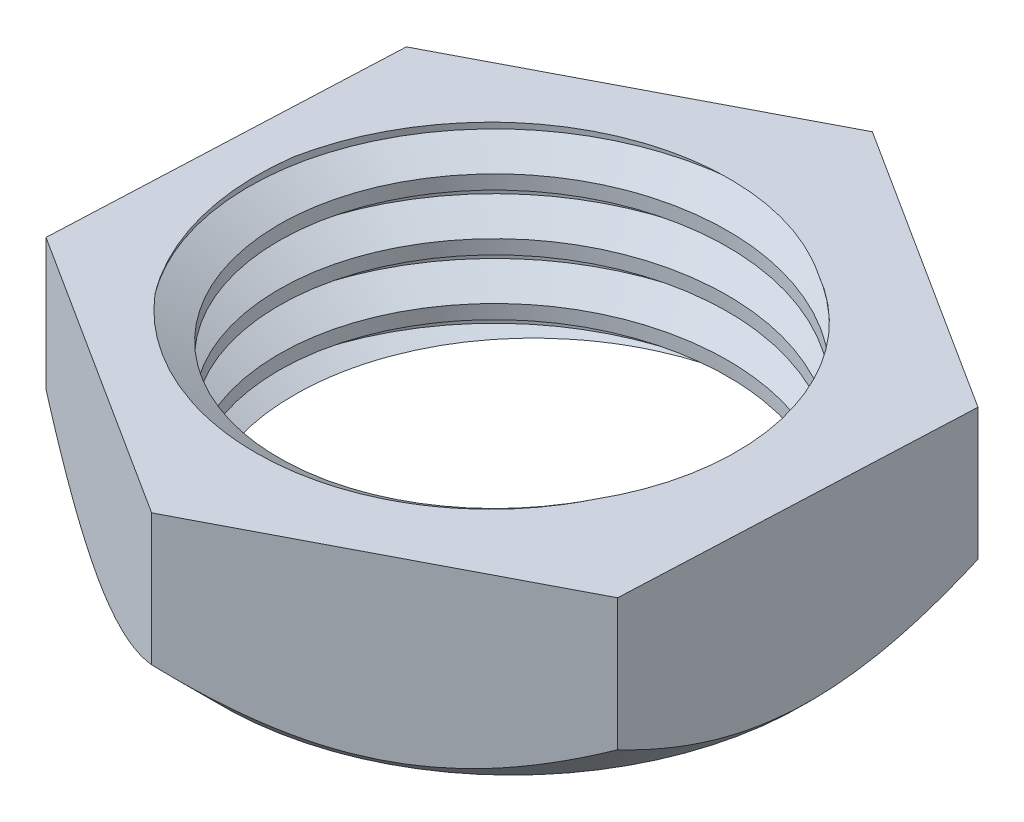
from build123d import *

# Parameters (mm, degrees)
SKETCH1_R           = 6
BOSS_EXTRUDE1_DEPTH = 5
THREAD1_PITCH       = 1.5
SKETCH5_OUTSIDE_W   = 43.428
SKETCH5_OUTSIDE_H   = 45.496
SKETCH5_OUTSIDE_R   = 7.756260738
CUT_EXTRUDE1_DEPTH  = 10
CUT_EXTRUDE1_DRAFT  = -45


with BuildPart() as part:
    # Sketch1 → Boss-Extrude1 (new body)
    with BuildSketch(Plane(origin=(0, 0, 0), x_dir=(1, 0, 0), z_dir=(0, 1, 0))):
        Polygon((7.789575032, -4.965466156), (8.195007349, 4.263236785), (0.405432317, 9.228702941), (-7.789575032, 4.965466156), (-8.195007349, -4.263236785), (-0.405432317, -9.228702941), align=None)
        with Locations(Location((0, 0, 0), (0, 0, 270))):
            Circle(SKETCH1_R, mode=Mode.SUBTRACT)
    extrude(amount=BOSS_EXTRUDE1_DEPTH)

    # Thread1: the profile of Thread Profile1 profile screwed along a right-hand helix of 9.84 turns, 8 arcs to a turn; built about Z, then put on its axis
    thread1_z = Axis((0, 0, 0), (0, 0, 1))
    thread1_corners = [(5.9997, 0, -0.000173205), (6.811898813, 0, 0.468749998), (6.811898813, 0, 0.656249998), (5.9997, 0, 1.125173201)]
    with BuildLine(mode=Mode.PRIVATE) as thread1_profile:
        Line(thread1_corners[0], thread1_corners[1])
        Line(thread1_corners[1], thread1_corners[2])
        Line(thread1_corners[2], thread1_corners[3])
        Line(thread1_corners[3], thread1_corners[0])
    thread1_cap = Face(thread1_profile.wire())
    thread1_turn_angles = [0, 22.5, 45, 67.5, 90, 112.5, 135, 157.5, 180, 202.5, 225, 247.5, 270, 292.5, 315, 337.5, 360]
    thread1_turn_weights = [1, 0.9238795325112867, 1, 0.9238795325112867, 1, 0.9238795325112867, 1, 0.9238795325112867, 1, 0.9238795325112867, 1, 0.9238795325112867, 1, 0.9238795325112867, 1, 0.9238795325112867, 1]
    thread1_turn_rails = [Edge.make_bspline([Vector(p[0], p[1], 0).rotate(thread1_z, thread1_turn_angles[k]) / thread1_turn_weights[k] + Vector(0, 0, p[2] + THREAD1_PITCH * thread1_turn_angles[k] / 360) for k in range(17)], [0, 0, 0, 1, 1, 2, 2, 3, 3, 4, 4, 5, 5, 6, 6, 7, 7, 8, 8, 8], 2, thread1_turn_weights) for p in thread1_corners]
    thread1_turn_sides = [Face.make_surface_from_curves(thread1_turn_rails[p[0]], thread1_turn_rails[p[1]]) for p in [(0, 1), (1, 2), (2, 3), (3, 0)]]
    thread1_last_angles = [3240, 3262.5, 3285, 3307.5, 3330, 3352.5, 3375, 3397.5, 3420, 3442.5, 3465, 3487.5, 3510, 3526.2, 3542.4]
    thread1_last_weights = [1, 0.9238795325112867, 1, 0.9238795325112867, 1, 0.9238795325112867, 1, 0.9238795325112867, 1, 0.9238795325112867, 1, 0.9238795325112867, 1, 0.9602936856769484, 1]
    thread1_last_rails = [Edge.make_bspline([Vector(p[0], p[1], 0).rotate(thread1_z, thread1_last_angles[k]) / thread1_last_weights[k] + Vector(0, 0, p[2] + THREAD1_PITCH * thread1_last_angles[k] / 360) for k in range(15)], [0, 0, 0, 1, 1, 2, 2, 3, 3, 4, 4, 5, 5, 6, 6, 7, 7, 7], 2, thread1_last_weights) for p in thread1_corners]
    thread1_last_sides = [Face.make_surface_from_curves(thread1_last_rails[p[0]], thread1_last_rails[p[1]]) for p in [(0, 1), (1, 2), (2, 3), (3, 0)]]
    thread1 = Plane(origin=(0, 10, 0), x_dir=(-1, 0, 0), z_dir=(0, -1, 0)) * Solid(Shell([*[p.moved(Location((0, 0, THREAD1_PITCH * i))) for i in range(9) for p in thread1_turn_sides], *thread1_last_sides, thread1_cap, thread1_cap.rotate(thread1_z, 3542.4).moved(Location((0, 0, THREAD1_PITCH * 3542.4 / 360)))]))
    add(thread1, mode=Mode.SUBTRACT)


with BuildPart() as cut_extrude1_tool:
    # Sketch5 outside → Cut-Extrude1 (with draft: the straight prism first)
    with BuildSketch(Plane(origin=(0, 0, 0), x_dir=(-1, 0, 0), z_dir=(0, -1, 0))):
        Rectangle(SKETCH5_OUTSIDE_W, SKETCH5_OUTSIDE_H)
        Circle(SKETCH5_OUTSIDE_R, mode=Mode.SUBTRACT)
    extrude(amount=-CUT_EXTRUDE1_DEPTH)
    # Cut-Extrude1: the draft: its side faces are tilted about the plane it starts from
    cut_extrude1_sides = [cut_extrude1_tool.faces().sort_by_distance(p)[0] for p in [
        (0, 5, 22.748),
        (-21.714, 5, 0),
        (0, 5, -22.748),
        (21.714, 5, 0),
        (7.756260738, 5, 0),
    ]]
    draft(cut_extrude1_sides, Plane(origin=(0, 0, 0), x_dir=(-1, 0, 0), z_dir=(0, -1, 0)), CUT_EXTRUDE1_DRAFT)


with BuildPart() as part_1:
    add(part.part)

    # Cut-Extrude1: cut by cut_extrude1_tool
    add(cut_extrude1_tool.part, mode=Mode.SUBTRACT)


solid = part_1.part
